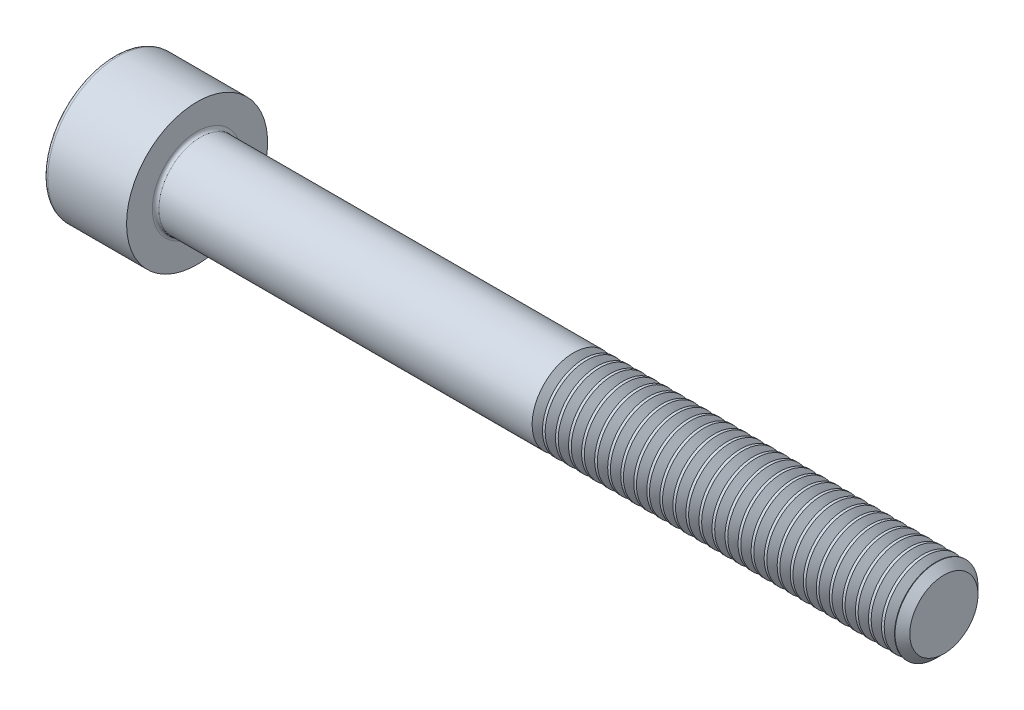
from build123d import *

# Parameters (mm, degrees)
FILLET1_R       = 0.2
FILLET2_R       = 0.25
HEX_2_DEPTH     = 2.5
THDSCHPAT_COUNT = 29
THDSCHPAT_PITCH = 0.785714286


with BuildPart() as part:
    # BodySke → Base-Revolve (revolve)
    with BuildSketch(Plane.XY):
        Polygon((0, 0), (0, 4.25), (5, 4.25), (5, 2.5), (49.555, 2.5), (50, 2.055), (50, 0), align=None)
    revolve(axis=Axis((-31.75, 0, 0), (1, 0, 0)))

    # Fillet1
    fillet1_edges = [part.edges().sort_by_distance(p)[0] for p in [
        (5, -2.5, 0),
    ]]
    fillet(fillet1_edges, radius=FILLET1_R)

    # Fillet2
    fillet2_edges = [part.edges().sort_by_distance(p)[0] for p in [
        (0, -4.25, 0),
    ]]
    fillet(fillet2_edges, radius=FILLET2_R)

    # Sketch2 → Hex-PreBroach (revolve, cut)
    with BuildSketch(Plane.XY):
        Polygon((0, 2.042), (2.5, 2.042), (3.67894925, 0), (0, 0), align=None)
    revolve(axis=Axis((0, 0, 0), (1, 0, 0)), mode=Mode.SUBTRACT)

    # Sketch3 → Hex 2 (cut)
    with BuildSketch(Plane(origin=(0, 0, 0), x_dir=(0, 0.500000000000001, 0.866025403784438), z_dir=(-1, 0, 0))):
        Polygon((1.17894925, 2.042), (-1.17894925, 2.042), (-2.357898499, 0), (-1.17894925, -2.042), (1.17894925, -2.042), (2.357898499, 0), align=None)
    extrude(amount=-HEX_2_DEPTH, mode=Mode.SUBTRACT)

    # ThdSchSke → ThreadSchematic (revolve, cut)
    with BuildSketch(Plane.XY):
        Polygon((28, -2.055), (27.688407645, -2.5), (27.688407645, -3.125), (28.311592355, -3.125), (28.311592355, -2.5), align=None)
    threadschematic = revolve(axis=Axis((-3.175, 0, 0), (1, 0, 0)), mode=Mode.SUBTRACT)

    # ThdSchPat: ThreadSchematic ×29
    with Locations(*[(i * THDSCHPAT_PITCH, 0, 0) for i in range(1, THDSCHPAT_COUNT)]):
        add(threadschematic, mode=Mode.SUBTRACT)


solid = part.part
